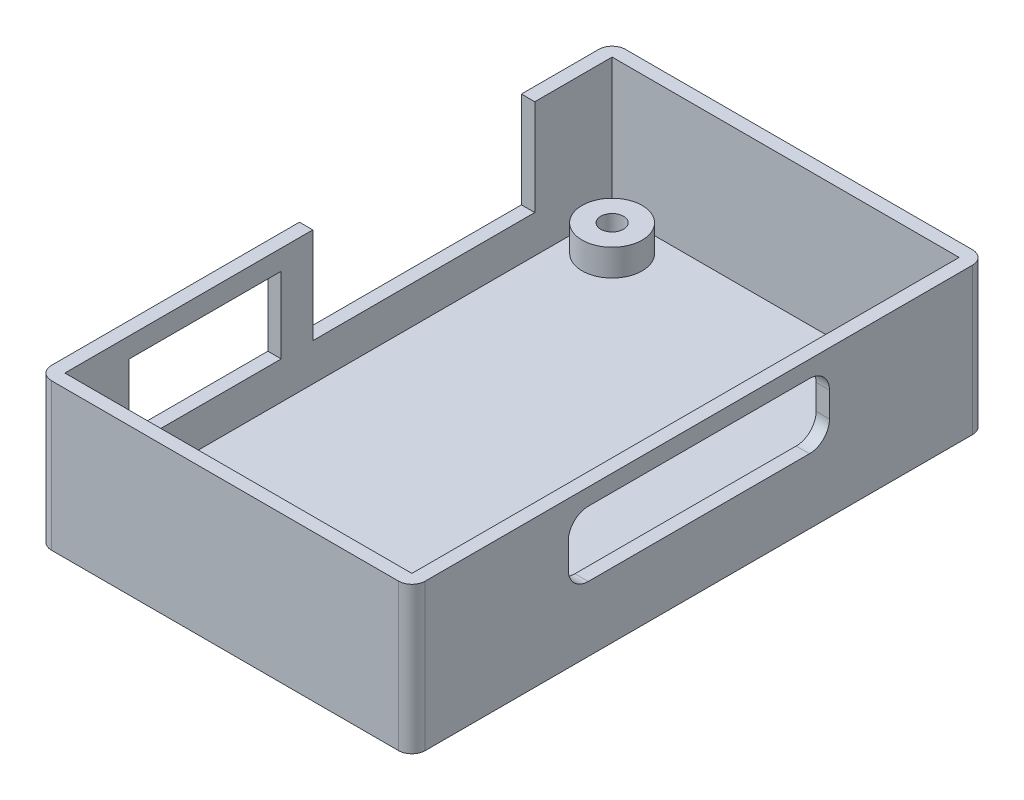
from build123d import *

# Parameters (mm, degrees)
SKIZZE1_W                                    = 56
SKIZZE1_H                                    = 86
AUFSATZ_LINEAR_AUSTRAGEN1_DEPTH              = 22
WANDUNG1_T                                   = -2
SKIZZE2_R                                    = 4.5
AUFSATZ_LINEAR_AUSTRAGEN2_DEPTH              = 4
VERRUNDUNG1_R                                = 2
SKIZZE3_W                                    = 22.84
SKIZZE3_H                                    = 11.38
SCHNITT_LINEAR_AUSTRAGEN1_DEPTH              = 2
STIRNSENKUNG_F_R_M3_ZYLINDERSCHRAUBE_2_COUNT = 2
STIRNSENKUNG_F_R_M3_ZYLINDERSCHRAUBE_2_PITCH = 81.987803971
STIRNSENKUNG_F_R_M3_ZYLINDERSCHRAUBE_3_COUNT = 2
STIRNSENKUNG_F_R_M3_ZYLINDERSCHRAUBE_3_PITCH = 71
STIRNSENKUNG_F_R_M3_ZYLINDERSCHRAUBE_4_COUNT = 2
STIRNSENKUNG_F_R_M3_ZYLINDERSCHRAUBE_4_PITCH = 41
SKIZZE7_W                                    = 33.26
SKIZZE7_H                                    = 14.38
SCHNITT_LINEAR_AUSTRAGEN2_DEPTH              = 10
SKIZZE8_W                                    = 39.14
SKIZZE8_H                                    = 9.76
SCHNITT_LINEAR_AUSTRAGEN3_DEPTH              = 10
VERRUNDUNG2_R                                = 3


with BuildPart() as part:
    # Skizze1 → Aufsatz-Linear austragen1 (new body)
    with BuildSketch(Plane(origin=(0, 0, 0), x_dir=(1, 0, 0), z_dir=(0, 1, 0))):
        with Locations((28, 43)):
            Rectangle(SKIZZE1_W, SKIZZE1_H)
    extrude(amount=AUFSATZ_LINEAR_AUSTRAGEN1_DEPTH)

    # Wandung1
    wandung1_openings = [part.faces().sort_by_distance(p)[0] for p in [
        (28, 22, -43),
    ]]
    offset(amount=WANDUNG1_T, openings=wandung1_openings, kind=Kind.INTERSECTION)

    # Skizze2 → Aufsatz-Linear austragen2 (add)
    with BuildSketch(Plane(origin=(0, 2, 0), x_dir=(1, 0, 0), z_dir=(0, 1, 0))):
        with Locations((7.5, 7.5)):
            Circle(SKIZZE2_R)
        with Locations((48.5, 7.5)):
            Circle(SKIZZE2_R)
        with Locations((48.5, 78.5)):
            Circle(SKIZZE2_R)
        with Locations((7.5, 78.5)):
            Circle(SKIZZE2_R)
    extrude(amount=AUFSATZ_LINEAR_AUSTRAGEN2_DEPTH)

    # Verrundung1
    verrundung1_edges = [part.edges().sort_by_distance(p)[0] for p in [
        (0, 11, -86),
        (56, 11, -86),
        (56, 11, 0),
        (0, 11, 0),
    ]]
    fillet(verrundung1_edges, radius=VERRUNDUNG1_R)

    # Skizze3 → Schnitt-Linear austragen1 (cut)
    with BuildSketch(Plane.ZY):
        with Locations((-23, 13.31)):
            Rectangle(SKIZZE3_W, SKIZZE3_H)
    extrude(amount=-SCHNITT_LINEAR_AUSTRAGEN1_DEPTH, mode=Mode.SUBTRACT)

    # Skizze6 → Stirnsenkung für M3 Zylinderschraube mit Innensechskant1 (revolve, cut)
    with BuildSketch(Plane(origin=(48.5, 0, -7.5), x_dir=(0, 0, -1), z_dir=(1, 0, 0))):
        Polygon((0, 0), (0, 15.021463052), (1.7, 14), (1.7, 3.4), (3.25, 3.4), (3.25, 0.025), (3.275, 0), align=None)
    stirnsenkung_f_r_m3_zylinderschraube_mit = revolve(axis=Axis((48.5, -6.35, -7.5), (0, 1, 0)), mode=Mode.SUBTRACT)

    # Stirnsenkung f_r M3 Zylinderschraube 2: Stirnsenkung für M3 Zylinderschraube mit Innensechskant1 ×2
    with Locations(*[Vector(-0.5000743770922673, 0, -0.865982457891487) * (i * STIRNSENKUNG_F_R_M3_ZYLINDERSCHRAUBE_2_PITCH) for i in range(1, STIRNSENKUNG_F_R_M3_ZYLINDERSCHRAUBE_2_COUNT)]):
        add(stirnsenkung_f_r_m3_zylinderschraube_mit, mode=Mode.SUBTRACT)

    # Stirnsenkung f_r M3 Zylinderschraube 3: Stirnsenkung für M3 Zylinderschraube mit Innensechskant1 ×2
    with Locations(*[(0, 0, -i * STIRNSENKUNG_F_R_M3_ZYLINDERSCHRAUBE_3_PITCH) for i in range(1, STIRNSENKUNG_F_R_M3_ZYLINDERSCHRAUBE_3_COUNT)]):
        add(stirnsenkung_f_r_m3_zylinderschraube_mit, mode=Mode.SUBTRACT)

    # Stirnsenkung f_r M3 Zylinderschraube 4: Stirnsenkung für M3 Zylinderschraube mit Innensechskant1 ×2
    with Locations(*[(-i * STIRNSENKUNG_F_R_M3_ZYLINDERSCHRAUBE_4_PITCH, 0, 0) for i in range(1, STIRNSENKUNG_F_R_M3_ZYLINDERSCHRAUBE_4_COUNT)]):
        add(stirnsenkung_f_r_m3_zylinderschraube_mit, mode=Mode.SUBTRACT)

    # Skizze7 → Schnitt-Linear austragen2 (cut)
    with BuildSketch(Plane.ZY):
        with Locations((-55.78, 14.81)):
            Rectangle(SKIZZE7_W, SKIZZE7_H)
    extrude(amount=-SCHNITT_LINEAR_AUSTRAGEN2_DEPTH, mode=Mode.SUBTRACT)

    # Skizze8 → Schnitt-Linear austragen3 (cut)
    with BuildSketch(Plane(origin=(56, 0, 0), x_dir=(0, 0, -1), z_dir=(1, 0, 0))):
        with Locations((43, 14.62)):
            Rectangle(SKIZZE8_W, SKIZZE8_H)
    extrude(amount=-SCHNITT_LINEAR_AUSTRAGEN3_DEPTH, mode=Mode.SUBTRACT)

    # Verrundung2
    verrundung2_edges = [part.edges().sort_by_distance(p)[0] for p in [
        (55, 9.74, -23.43),
        (55, 9.74, -62.57),
        (55, 19.5, -62.57),
        (55, 19.5, -23.43),
    ]]
    fillet(verrundung2_edges, radius=VERRUNDUNG2_R)


solid = part.part
